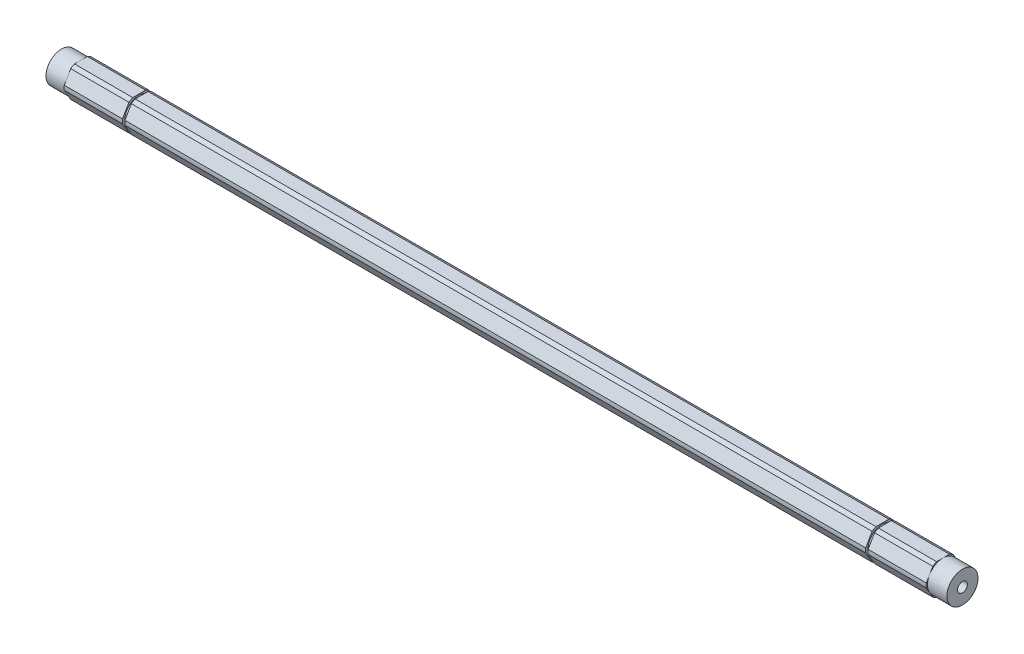
from build123d import *

# Parameters (mm, degrees)
SKETCH1_R               = 2.0193
BOSS_EXTRUDE1_DEPTH     = 184.15
SKETCH2_R               = 8.89
SKETCH2_R_2             = 6.35
CUT_EXTRUDE_THIN1_DEPTH = 7.9375
SKETCH4_W               = 0.9906
SKETCH4_H               = 2.802626001


with BuildPart() as part:
    # Sketch1 → Boss-Extrude1 (new, symmetric)
    with BuildSketch(Plane(origin=(0, 0, 0), x_dir=(0, 0, -1), z_dir=(1, 0, 0))):
        with BuildLine():
            ThreePointArc((6.874999966, 0), (6.860422465, 0.447468582), (6.816751782, 0.893039571))
            Line((6.816751782, 0.893039571), (4.181770846, 5.456960429))
            ThreePointArc((4.181770846, 5.456960429), (3.437499983, 5.953924622), (2.634980936, 6.35))
            Line((2.634980936, 6.35), (-2.634980936, 6.35))
            ThreePointArc((-2.634980936, 6.35), (-3.437499983, 5.953924622), (-4.181770846, 5.456960429))
            Line((-4.181770846, 5.456960429), (-6.816751782, 0.893039571))
            ThreePointArc((-6.816751782, 0.893039571), (-6.874999966, 0), (-6.816751782, -0.893039571))
            Line((-6.816751782, -0.893039571), (-4.181770846, -5.456960429))
            ThreePointArc((-4.181770846, -5.456960429), (-3.437499983, -5.953924622), (-2.634980936, -6.35))
            Line((-2.634980936, -6.35), (2.634980936, -6.35))
            ThreePointArc((2.634980936, -6.35), (3.437499983, -5.953924622), (4.181770846, -5.456960429))
            Line((4.181770846, -5.456960429), (6.816751782, -0.893039571))
            ThreePointArc((6.816751782, -0.893039571), (6.860422465, -0.447468582), (6.874999966, 0))
        make_face()
        Circle(SKETCH1_R, mode=Mode.SUBTRACT)
    extrude(amount=BOSS_EXTRUDE1_DEPTH, both=True)

    # Sketch2 → Cut-Extrude-Thin1 (cut)
    with BuildSketch(Plane(origin=(184.15, 0, 0), x_dir=(0, 0, -1), z_dir=(1, 0, 0))):
        Circle(SKETCH2_R)
        Circle(SKETCH2_R_2, mode=Mode.SUBTRACT)
    cut_extrude_thin1 = extrude(amount=-CUT_EXTRUDE_THIN1_DEPTH, mode=Mode.SUBTRACT)

    # Mirror1: Cut-Extrude-Thin1 across plane
    add(cut_extrude_thin1.mirror(Plane(origin=(0, 0, 0), x_dir=(0, 0, 1), z_dir=(1, 0, 0))), mode=Mode.SUBTRACT)

    # Sketch4 → Cut-Revolve7 (revolve, cut)
    with BuildSketch(Plane.XY):
        with Locations((151.9047, 7.256013001)):
            Rectangle(SKETCH4_W, SKETCH4_H)
    cut_revolve7 = revolve(axis=Axis((184.15, 0, 0), (-1, 0, 0)), mode=Mode.SUBTRACT)

    # Mirror2: Cut-Revolve7 across plane
    add(cut_revolve7.mirror(Plane(origin=(0, 0, 0), x_dir=(0, 0, 1), z_dir=(1, 0, 0))), mode=Mode.SUBTRACT)


solid = part.part
